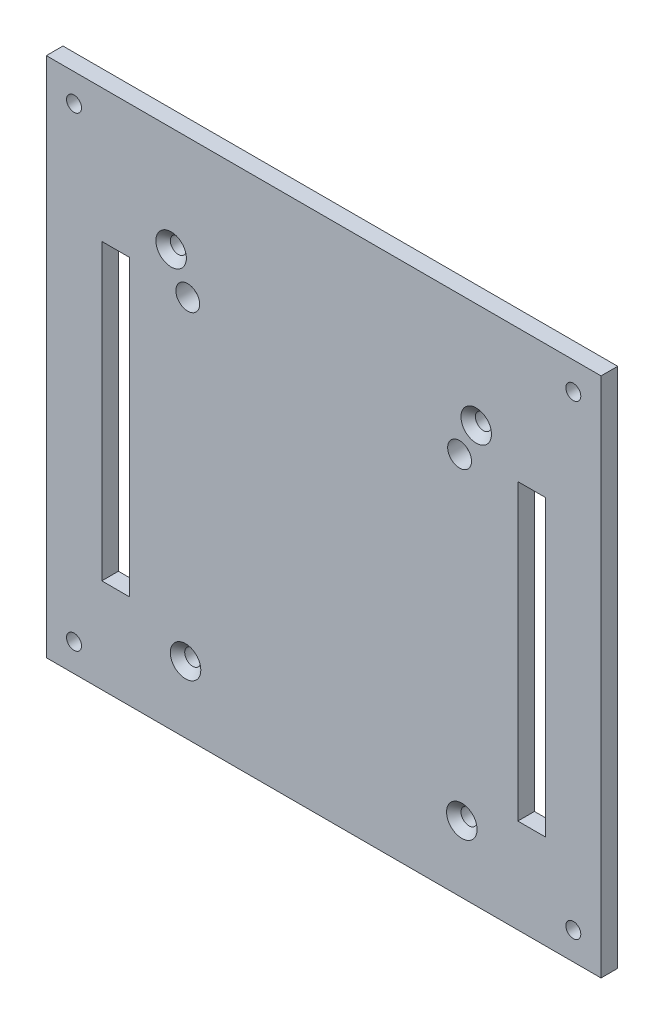
from build123d import *

# Parameters (mm, degrees)
CROQUIS1_W                                           = 100
CROQUIS1_H                                           = 82
SALIENTE_EXTRUIR1_DEPTH                              = 3
AVELLANADO_PARA_TORNILLO_CON_CABEZA_PLAN_D           = 2.9
AVELLANADO_PARA_TORNILLO_CON_CABEZA_PLAN_CSINK_D     = 5.5
AVELLANADO_PARA_TORNILLO_CON_CABEZA_PLAN_CSINK_ANGLE = 90
CORTAR_EXTRUIR1_REACH                                = 131.356
CROQUIS6_W                                           = 5
CROQUIS6_H                                           = 53
CROQUIS7_W                                           = 100
CROQUIS7_H                                           = 3
SALIENTE_EXTRUIR2_DEPTH                              = 6
CROQUIS8_W                                           = 100
CROQUIS8_H                                           = 3
SALIENTE_EXTRUIR3_DEPTH                              = 6
TALADRO_DE_MARGEN_PARA_M2_51_D                       = 2.7
TALADRO_DE_MARGEN_PARA_M41_D                         = 4.3


with BuildPart() as part:
    # Croquis1 → Saliente-Extruir1 (new body)
    with BuildSketch(Plane.XY):
        with Locations((50, 41)):
            Rectangle(CROQUIS1_W, CROQUIS1_H)
    extrude(amount=SALIENTE_EXTRUIR1_DEPTH)

    # Avellanado para tornillo con cabeza plana avellanada de M2.51 (through all)
    with Locations(Plane(origin=(22.5, 69, 3), x_dir=(1, 0, 0), z_dir=(0, 0, 1))):
        with Locations((0, 0), (55, 0), (52.4, -63), (2.6, -63)):
            CounterSinkHole(AVELLANADO_PARA_TORNILLO_CON_CABEZA_PLAN_D / 2, AVELLANADO_PARA_TORNILLO_CON_CABEZA_PLAN_CSINK_D / 2, counter_sink_angle=AVELLANADO_PARA_TORNILLO_CON_CABEZA_PLAN_CSINK_ANGLE)

    # Croquis6 → Cortar-Extruir1 (cut, up to next)
    with BuildSketch(Plane.XY.offset(3), mode=Mode.PRIVATE) as cortar_extruir1_sk1:
        with Locations((12.5, 37.5)):
            Rectangle(CROQUIS6_W, CROQUIS6_H)
    cortar_extruir1_tool1 = extrude(cortar_extruir1_sk1.sketch, amount=-CORTAR_EXTRUIR1_REACH, mode=Mode.PRIVATE) & part.part
    # Croquis6 → Cortar-Extruir1 (cut, up to next)
    with BuildSketch(Plane.XY.offset(3), mode=Mode.PRIVATE) as cortar_extruir1_sk2:
        with Locations((87.5, 37.5)):
            Rectangle(CROQUIS6_W, CROQUIS6_H)
    cortar_extruir1_tool2 = extrude(cortar_extruir1_sk2.sketch, amount=-CORTAR_EXTRUIR1_REACH, mode=Mode.PRIVATE) & part.part
    add(cortar_extruir1_tool1.solids().sort_by_distance((12.5, 37.5, 3))[0], mode=Mode.SUBTRACT)
    add(cortar_extruir1_tool2.solids().sort_by_distance((87.5, 37.5, 3))[0], mode=Mode.SUBTRACT)

    # Croquis7 → Saliente-Extruir2 (add)
    with BuildSketch(Plane(origin=(0, 82, 0), x_dir=(1, 0, 0), z_dir=(0, 1, 0))):
        with Locations((50, -1.5)):
            Rectangle(CROQUIS7_W, CROQUIS7_H)
    extrude(amount=SALIENTE_EXTRUIR2_DEPTH)

    # Croquis8 → Saliente-Extruir3 (add)
    with BuildSketch(Plane.XZ):
        with Locations((50, 1.5)):
            Rectangle(CROQUIS8_W, CROQUIS8_H)
    extrude(amount=SALIENTE_EXTRUIR3_DEPTH)

    # Taladro de margen para M2.51 (through all)
    with Locations(Plane(origin=(5, 83, 3), x_dir=(1, 0, 0), z_dir=(0, 0, 1))):
        with Locations((0, 0), (0, -84), (90, -84), (90, 0)):
            Hole(TALADRO_DE_MARGEN_PARA_M2_51_D / 2)

    # Taladro de margen para M41 (through all)
    with Locations(Plane(origin=(25.5, 63, 3), x_dir=(1, 0, 0), z_dir=(0, 0, 1))):
        with Locations((0, 0), (49, 0)):
            Hole(TALADRO_DE_MARGEN_PARA_M41_D / 2)


solid = part.part
